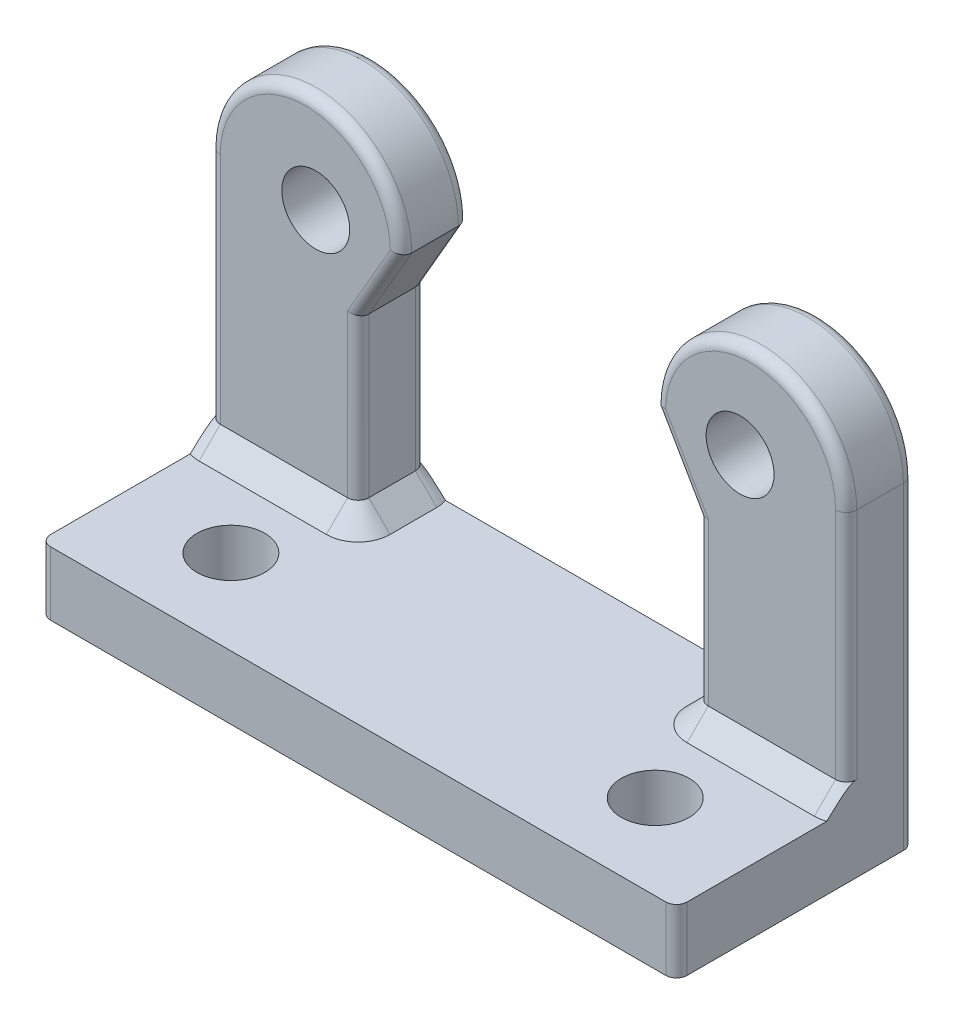
from build123d import *

# Parameters (mm, degrees)
SKETCH1_R           = 1.6
BOSS_EXTRUDE1_DEPTH = 3.2
SKETCH2_W           = 30
SKETCH2_H           = 3
BOSS_EXTRUDE2_DEPTH = 8
SKETCH3_R           = 1.6
CUT_EXTRUDE1_DEPTH  = 25.960610678
FILLET1_R           = 0.5
CHAMFER1_SIZE       = 1


with BuildPart() as part:
    # Sketch1 → Boss-Extrude1 (new body)
    with BuildSketch(Plane.XY):
        with BuildLine():
            Line((-15, -3), (15, -3))
            Line((15, -3), (15, 12))
            ThreePointArc((15, 12), (10.489637029, 16.510362971), (5.979274058, 12))
            Line((5.979274058, 12), (8, 8.5))
            Line((8, 8.5), (8, 0))
            Line((8, 0), (-8, 0))
            Line((-8, 0), (-8, 8.5))
            Line((-8, 8.5), (-5.979274058, 12))
            ThreePointArc((-5.979274058, 12), (-10.489637029, 16.510362971), (-15, 12))
            Line((-15, 12), (-15, -3))
        make_face()
        with Locations((-10, 12)):
            Circle(SKETCH1_R, mode=Mode.SUBTRACT)
        with Locations((10, 12)):
            Circle(SKETCH1_R, mode=Mode.SUBTRACT)
    extrude(amount=BOSS_EXTRUDE1_DEPTH)

    # Sketch2 → Boss-Extrude2 (add)
    with BuildSketch(Plane.XY.offset(3.2)):
        with Locations((0, -1.5)):
            Rectangle(SKETCH2_W, SKETCH2_H)
    extrude(amount=BOSS_EXTRUDE2_DEPTH)

    # Sketch3 → Cut-Extrude1 (cut, through all)
    with BuildSketch(Plane(origin=(0, 0, 0), x_dir=(1, 0, 0), z_dir=(0, 1, 0))):
        with Locations(Location((-10, -7.2, 0), (0, 0, 270))):
            Circle(SKETCH3_R)
        with Locations(Location((10, -7.2, 0), (0, 0, 270))):
            Circle(SKETCH3_R)
    extrude(amount=-CUT_EXTRUDE1_DEPTH, mode=Mode.SUBTRACT)

    # Fillet1
    fillet1_edges = [part.edges().sort_by_distance(p)[0] for p in [
        (8, 4.25, 0),
        (6.989637029, 10.25, 0),
        (10.489637029, 16.510362971, 0),
        (15, 4.5, 0),
        (-15, 4.5, 0),
        (-10.489637029, 16.510362971, 0),
        (10.489637029, 16.510362971, 3.2),
        (6.989637029, 10.25, 3.2),
        (8, 4.25, 3.2),
        (-8, 4.25, 3.2),
        (-6.989637029, 10.25, 3.2),
        (15, 6, 3.2),
        (-10.489637029, 16.510362971, 3.2),
        (-15, -1.5, 11.2),
        (15, -1.5, 11.2),
        (-15, 6, 3.2),
        (-6.989637029, 10.25, 0),
        (-8, 4.25, 0),
    ]]
    fillet(fillet1_edges, radius=FILLET1_R)

    # Chamfer1
    # the kernel refuses this chamfer: 1 mm, written as the material it adds along each edge
    with BuildSketch(Plane(origin=(-8.5, 0, 3.2), x_dir=(0, 0.9996219169112968, -0.027495876610586494), z_dir=(-1, 0, 0)), Plane(origin=(14.5, 0, 3.2), x_dir=(0, 0.9996219169112968, -0.027495876610586494), z_dir=(-1, 0, 0))) as chamfer1_piece_1:
        Polygon((CHAMFER1_SIZE * 0.999621916911, -CHAMFER1_SIZE * 0.0274958766106), (-CHAMFER1_SIZE * 0.0274958766106, -CHAMFER1_SIZE * 0.999621916911), (0, 0), align=None)
    extrude(amount=6)
    with BuildSketch(Plane(origin=(-8, 0, 0.5), x_dir=(-0.02749587661058563, 0.9996219169112968, 0), z_dir=(0, 0, 1))) as chamfer1_piece_2:
        Polygon((CHAMFER1_SIZE * 0.999621916911, -CHAMFER1_SIZE * 0.0274958766106), (-CHAMFER1_SIZE * 0.0274958766106, -CHAMFER1_SIZE * 0.999621916911), (0, 0), align=None)
    extrude(amount=2.2)
    with BuildSketch(Plane(origin=(8, 0, 0.5), x_dir=(0.027495876610585633, 0.9996219169112968, 0), z_dir=(0, 0, 1))) as chamfer1_piece_3:
        Polygon((CHAMFER1_SIZE * 0.999621916911, CHAMFER1_SIZE * 0.0274958766106), (-CHAMFER1_SIZE * 0.0274958766106, CHAMFER1_SIZE * 0.999621916911), (0, 0), align=None)
    extrude(amount=2.2)
    with BuildSketch(Plane(origin=(-14.5, 0, 2.7), x_dir=(0.006283143965557512, 0, 0.9999802608561372), z_dir=(-0.9999802608561372, 0, 0.006283143965557512))) as chamfer1_piece_4_section:
        Polygon((-0.5 - CHAMFER1_SIZE, 0), (-0.5, CHAMFER1_SIZE), (-0.5, 0), align=None)
    chamfer1_piece_4 = revolve(axis=Axis((-14.5, 0, 2.7), (0, 1, 0)), revolution_arc=359.64, mode=Mode.PRIVATE)
    chamfer1_piece_4 = split(chamfer1_piece_4, bisect_by=Plane(origin=(-15, 0.469782675, 3.086220861), z_dir=(1, 0, 0)), keep=Keep.TOP, mode=Mode.PRIVATE)
    add(chamfer1_piece_4)
    with BuildSketch(Plane(origin=(-8.5, 0, 0.5), x_dir=(0.9999802608561372, 0, 0.006283143965558622), z_dir=(0.006283143965558622, 0, -0.9999802608561372))) as chamfer1_piece_5_section:
        Polygon((-0.5, -CHAMFER1_SIZE), (-0.5 - CHAMFER1_SIZE, 0), (-0.5, 0), align=None)
    chamfer1_piece_5 = revolve(axis=Axis((-8.5, 0, 0.5), (0, -1, 0)), revolution_arc=359.64, mode=Mode.PRIVATE)
    chamfer1_piece_5 = split(chamfer1_piece_5, bisect_by=Plane(origin=(-8.113779143, 0.469782674, 0), z_dir=(0, 0, 1)), keep=Keep.TOP, mode=Mode.PRIVATE)
    add(chamfer1_piece_5)
    with BuildSketch(Plane(origin=(8.5, 0, 2.7), x_dir=(-1, 0, 0), z_dir=(0, 0, -1))) as chamfer1_piece_6:
        Polygon((0.5, CHAMFER1_SIZE), (0.5 + CHAMFER1_SIZE, 0), (0.5, 0), align=None)
    revolve(axis=Axis((8.5, 0, 2.7), (0, 1, 0)), revolution_arc=90)
    with BuildSketch(Plane(origin=(8.5, 0, 0.5), x_dir=(-0.9999802608561372, 0, 0.006283143965558622), z_dir=(-0.006283143965558622, 0, -0.9999802608561372))) as chamfer1_piece_7_section:
        Polygon((-0.5, CHAMFER1_SIZE), (-0.5 - CHAMFER1_SIZE, 0), (-0.5, 0), align=None)
    chamfer1_piece_7 = revolve(axis=Axis((8.5, 0, 0.5), (0, 1, 0)), revolution_arc=359.64, mode=Mode.PRIVATE)
    chamfer1_piece_7 = split(chamfer1_piece_7, bisect_by=Plane(origin=(8.113779139, 0.469782675, 0), z_dir=(0, 0, 1)), keep=Keep.TOP, mode=Mode.PRIVATE)
    add(chamfer1_piece_7)
    with BuildSketch(Plane(origin=(14.5, 0, 2.7), x_dir=(0, 0, 1), z_dir=(-1, 0, 0))) as chamfer1_piece_8_section:
        Polygon((0.5, CHAMFER1_SIZE), (0.5 + CHAMFER1_SIZE, 0), (0.5, 0), align=None)
    chamfer1_piece_8 = revolve(axis=Axis((14.5, 0, 2.7), (0, 1, 0)), revolution_arc=359.64, mode=Mode.PRIVATE)
    chamfer1_piece_8 = split(chamfer1_piece_8, bisect_by=Plane(origin=(15, 0.469782675, 3.086220861), z_dir=(-1, 0, 0)), keep=Keep.TOP, mode=Mode.PRIVATE)
    add(chamfer1_piece_8)
    with BuildSketch(Plane(origin=(-8.5, 0, 2.7), x_dir=(0, 0, 1), z_dir=(-1, 0, 0))) as chamfer1_piece_9:
        Polygon((0.5, CHAMFER1_SIZE), (0.5 + CHAMFER1_SIZE, 0), (0.5, 0), align=None)
    revolve(axis=Axis((-8.5, 0, 2.7), (0, 1, 0)), revolution_arc=90)


solid = part.part
